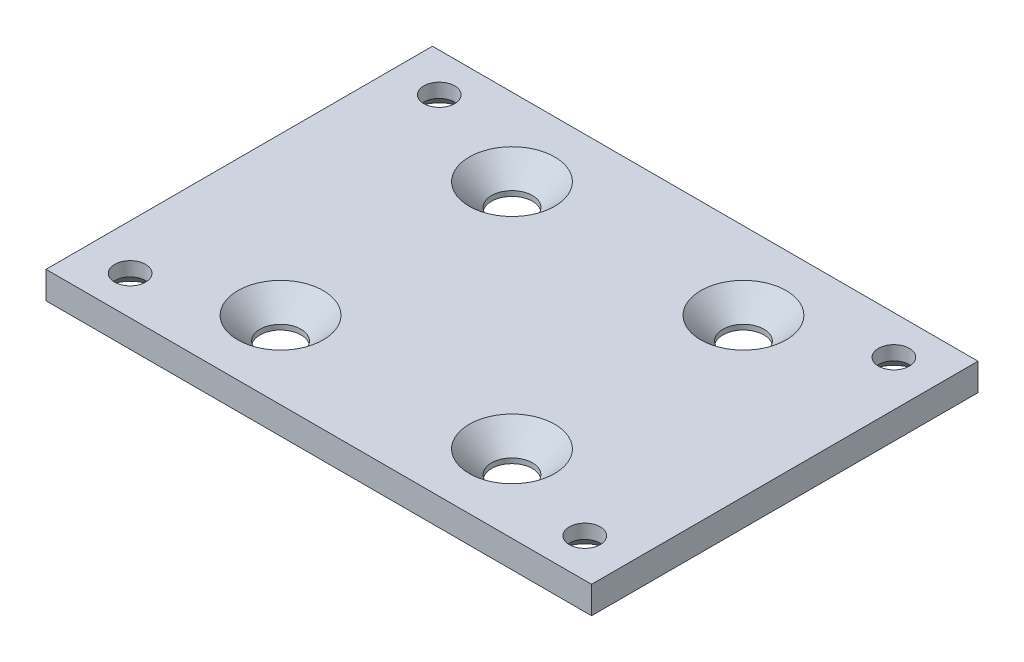
from build123d import *

# Parameters (mm, degrees)
BASE_PLATE_W              = 60
BASE_PLATE_H              = 42.5
BOSS_EXTRUDE1_DEPTH       = 3
MOTOR_HOLES_M4_AT_2_COUNT = 2
MOTOR_HOLES_M4_AT_2_PITCH = 25.455844123
MOTOR_HOLES_M4_AT_3_COUNT = 2
MOTOR_HOLES_M4_AT_3_PITCH = 36
MOTOR_HOLES_M4_AT_4_COUNT = 2
MOTOR_HOLES_M4_AT_4_PITCH = 25.455844123
CLAMP_HOLES_M3_AT_2_COUNT = 2
CLAMP_HOLES_M3_AT_2_PITCH = 60.464865831
CLAMP_HOLES_M3_AT_3_COUNT = 2
CLAMP_HOLES_M3_AT_3_PITCH = 50
CLAMP_HOLES_M3_AT_4_COUNT = 2
CLAMP_HOLES_M3_AT_4_PITCH = 34


with BuildPart() as part:
    # Base Plate → Boss-Extrude1 (new body)
    with BuildSketch(Plane(origin=(0, 0, 0), x_dir=(1, 0, 0), z_dir=(0, 1, 0))):
        Rectangle(BASE_PLATE_W, BASE_PLATE_H)
    extrude(amount=BOSS_EXTRUDE1_DEPTH)

    # Sketch4 → Motor Holes M4 (revolve, cut)
    with BuildSketch(Plane(origin=(-12.727922061, 3, 12.727922061), x_dir=(0, 0, 1), z_dir=(1, 0, 0))):
        Polygon((0, 0), (0, 3), (2.25, 3), (2.25, 2.45), (4.7, 0), align=None)
    motor_holes_m4 = revolve(axis=Axis((-12.727922061, 9.35, 12.727922061), (0, -1, 0)), mode=Mode.SUBTRACT)

    # Motor Holes M4 at 2: Motor Holes M4 ×2
    with Locations(*[(0, 0, -i * MOTOR_HOLES_M4_AT_2_PITCH) for i in range(1, MOTOR_HOLES_M4_AT_2_COUNT)]):
        add(motor_holes_m4, mode=Mode.SUBTRACT)

    # Motor Holes M4 at 3: Motor Holes M4 ×2
    with Locations(*[Vector(0.7071067811865291, 0, -0.707106781186566) * (i * MOTOR_HOLES_M4_AT_3_PITCH) for i in range(1, MOTOR_HOLES_M4_AT_3_COUNT)]):
        add(motor_holes_m4, mode=Mode.SUBTRACT)

    # Motor Holes M4 at 4: Motor Holes M4 ×2
    with Locations(*[(i * MOTOR_HOLES_M4_AT_4_PITCH, 0, 0) for i in range(1, MOTOR_HOLES_M4_AT_4_COUNT)]):
        add(motor_holes_m4, mode=Mode.SUBTRACT)

    # Sketch6 → Clamp Holes M3 (revolve, cut)
    with BuildSketch(Plane(origin=(-25, 0, -17), x_dir=(0, 0, -1), z_dir=(1, 0, 0))):
        Polygon((0, 0), (0, 3), (1.7, 3), (1.7, 1.45), (3.15, 0), align=None)
    clamp_holes_m3 = revolve(axis=Axis((-25, -6.35, -17), (0, 1, 0)), mode=Mode.SUBTRACT)

    # Clamp Holes M3 at 2: Clamp Holes M3 ×2
    with Locations(*[Vector(0.8269265020695281, 0, 0.5623100214072791) * (i * CLAMP_HOLES_M3_AT_2_PITCH) for i in range(1, CLAMP_HOLES_M3_AT_2_COUNT)]):
        add(clamp_holes_m3, mode=Mode.SUBTRACT)

    # Clamp Holes M3 at 3: Clamp Holes M3 ×2
    with Locations(*[(i * CLAMP_HOLES_M3_AT_3_PITCH, 0, 0) for i in range(1, CLAMP_HOLES_M3_AT_3_COUNT)]):
        add(clamp_holes_m3, mode=Mode.SUBTRACT)

    # Clamp Holes M3 at 4: Clamp Holes M3 ×2
    with Locations(*[(0, 0, i * CLAMP_HOLES_M3_AT_4_PITCH) for i in range(1, CLAMP_HOLES_M3_AT_4_COUNT)]):
        add(clamp_holes_m3, mode=Mode.SUBTRACT)


solid = part.part
